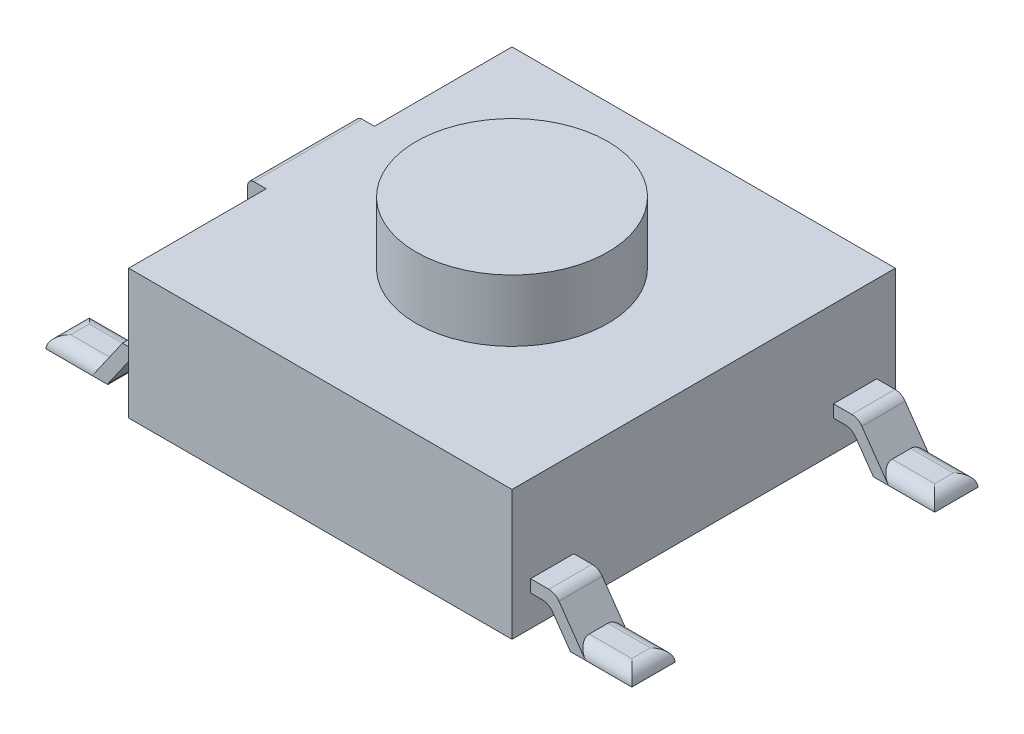
from build123d import *

# Parameters (mm, degrees)
ESQUISSE1_W         = 6.2
ESQUISSE1_H         = 6.2
BOSS_EXTRU_1_DEPTH  = 2.1
ESQUISSE2_R         = 1.55
BOSS_EXTRU_2_DEPTH  = 1
ESQUISSE3_W         = 1.75
ESQUISSE3_H         = 2.1
BOSS_EXTRU_3_DEPTH  = 0.3
ESQUISSE4_W         = 0.9
ESQUISSE4_H         = 0.1
BOSS_EXTRU_4_DEPTH  = 0.7
CONG_1_R            = 0.1
ESQUISSE5_W         = 0.7
ESQUISSE5_H         = 0.2
BOSS_EXTRU_5_DEPTH  = 0.4
ESQUISSE7_W         = 0.7
ESQUISSE7_H         = 0.2
BOSS_EXTRU_6_DEPTH  = 0.7
CONG_2_R            = 0.2
ESQUISSE9_W         = 1
ESQUISSE9_H         = 0.7
BOSS_EXTRU_7_DEPTH  = 0.2
CONG_3_R            = 0.2
CONG_4_R            = 0.2
ESQUISSE10_W        = 0.7
ESQUISSE10_H        = 0.2
BOSS_EXTRU_10_DEPTH = 0.4
ESQUISSE14_W        = 0.7
ESQUISSE14_H        = 0.2
BOSS_EXTRU_11_DEPTH = 0.7
ESQUISSE16_W        = 1
ESQUISSE16_H        = 0.7
BOSS_EXTRU_12_DEPTH = 0.2
CONG_5_R            = 0.2


with BuildPart() as part:
    # Esquisse1 → Boss.-Extru.1 (new body)
    with BuildSketch(Plane(origin=(0, 0, 0), x_dir=(1, 0, 0), z_dir=(0, 1, 0))):
        with Locations((3.1, 3.1)):
            Rectangle(ESQUISSE1_W, ESQUISSE1_H)
    extrude(amount=BOSS_EXTRU_1_DEPTH)

    # Esquisse2 → Boss.-Extru.2 (add)
    with BuildSketch(Plane(origin=(0, 2.1, 0), x_dir=(1, 0, 0), z_dir=(0, 1, 0))):
        with Locations(Location((3.1, 3.1, 0), (0, 0, 90))):
            Circle(ESQUISSE2_R)
    extrude(amount=BOSS_EXTRU_2_DEPTH)

    # Esquisse3 → Boss.-Extru.3 (add)
    with BuildSketch(Plane.ZY):
        with Locations((-3.1, 1.05)):
            Rectangle(ESQUISSE3_W, ESQUISSE3_H)
    extrude(amount=BOSS_EXTRU_3_DEPTH)

    # Esquisse4 → Boss.-Extru.4 (add)
    with BuildSketch(Plane.ZY.offset(0.3)):
        with Locations((-3.1, 0.05)):
            Rectangle(ESQUISSE4_W, ESQUISSE4_H)
    extrude(amount=BOSS_EXTRU_4_DEPTH)

    # Congé1
    cong_1_edges = [part.edges().sort_by_distance(p)[0] for p in [
        (-0.65, 0.1, -3.55),
        (-0.65, 0.1, -2.65),
        (-1, 0.1, -3.1),
        (-0.3, 2.1, -3.1),
    ]]
    fillet(cong_1_edges, radius=CONG_1_R - 0.0001)  # a hair under: the kernel refuses the full size
    cong_1_2_edges = [part.edges().sort_by_distance(p)[0] for p in [
        (-0.3, 0.1, -3.1),
        (-0.3, 0.070739967, -3.520739967),
        (-0.3, 0.070739967, -2.679260033),
    ]]
    fillet(cong_1_2_edges, radius=CONG_1_R)

    # Esquisse5 → Boss.-Extru.5 (add)
    with BuildSketch(Plane(origin=(6.2, 0, 0), x_dir=(0, 0, -1), z_dir=(1, 0, 0))):
        with Locations((0.65, 0.6)):
            Rectangle(ESQUISSE5_W, ESQUISSE5_H)
        with Locations((5.55, 0.6)):
            Rectangle(ESQUISSE5_W, ESQUISSE5_H)
    extrude(amount=BOSS_EXTRU_5_DEPTH)

    # Esquisse7 → Boss.-Extru.6 (add)
    with BuildSketch(Plane(origin=(1.84244111, -2.631278598, 0), x_dir=(0, 0, -1), z_dir=(-0.5735764363510502, 0.8191520442889889, 0))):
        with Locations((5.55, -5.707906998)):
            Rectangle(ESQUISSE7_W, ESQUISSE7_H)
        with Locations((0.65, -5.707906998)):
            Rectangle(ESQUISSE7_W, ESQUISSE7_H)
    extrude(amount=-BOSS_EXTRU_6_DEPTH)

    # Congé2
    cong_2_edges = [part.edges().sort_by_distance(p)[0] for p in [
        (6.49588659, 0.5, -5.55),
        (6.49588659, 0.5, -0.65),
        (6.6, 0.7, -0.65),
        (6.6, 0.7, -5.55),
    ]]
    fillet(cong_2_edges, radius=CONG_2_R)

    # Esquisse9 → Boss.-Extru.7 (add)
    with BuildSketch(Plane(origin=(0, 0, 0), x_dir=(1, 0, 0), z_dir=(0, 1, 0))):
        with Locations((7.337673097, 0.65)):
            Rectangle(ESQUISSE9_W, ESQUISSE9_H)
        with Locations((7.337673097, 5.55)):
            Rectangle(ESQUISSE9_W, ESQUISSE9_H)
    extrude(amount=BOSS_EXTRU_7_DEPTH)

    # Congé3
    cong_3_edges = [part.edges().sort_by_distance(p)[0] for p in [
        (7.837673097, 0.2, -0.65),
        (7.393888433, 0.2, -1),
        (7.393888433, 0.2, -0.3),
    ]]
    fillet(cong_3_edges, radius=CONG_3_R - 0.0001)  # a hair under: the kernel refuses the full size

    # Congé4
    cong_4_edges = [part.edges().sort_by_distance(p)[0] for p in [
        (7.393888433, 0.2, -5.9),
        (7.837673097, 0.2, -5.55),
        (7.393888433, 0.2, -5.2),
    ]]
    fillet(cong_4_edges, radius=CONG_4_R - 0.0001)  # a hair under: the kernel refuses the full size

    # Esquisse10 → Boss.-Extru.10 (add)
    with BuildSketch(Plane.ZY):
        with Locations((-5.55, 0.6)):
            Rectangle(ESQUISSE10_W, ESQUISSE10_H)
        with Locations((-0.65, 0.6)):
            Rectangle(ESQUISSE10_W, ESQUISSE10_H)
    extrude(amount=BOSS_EXTRU_10_DEPTH)

    # Esquisse14 → Boss.-Extru.11 (add)
    with BuildSketch(Plane(origin=(0.197296446, 0.281768526, 0), x_dir=(0, 0, -1), z_dir=(-0.5735764363510527, -0.8191520442889871, 0))):
        with Locations((0.65, -0.629164323)):
            Rectangle(ESQUISSE14_W, ESQUISSE14_H)
        with Locations((5.55, -0.629164323)):
            Rectangle(ESQUISSE14_W, ESQUISSE14_H)
    extrude(amount=BOSS_EXTRU_11_DEPTH)

    # Esquisse16 → Boss.-Extru.12 (add)
    with BuildSketch(Plane(origin=(0, 0, 0), x_dir=(1, 0, 0), z_dir=(0, 1, 0))):
        with Locations((-1.137673097, 0.65)):
            Rectangle(ESQUISSE16_W, ESQUISSE16_H)
        with Locations((-1.137673097, 5.55)):
            Rectangle(ESQUISSE16_W, ESQUISSE16_H)
    extrude(amount=BOSS_EXTRU_12_DEPTH)

    # Congé5
    cong_5_edges = [part.edges().sort_by_distance(p)[0] for p in [
        (-1.193888433, 0.2, -5.9),
        (-1.637673097, 0.2, -5.55),
        (-1.193888433, 0.2, -5.2),
        (-1.193888433, 0.2, -1),
        (-1.637673097, 0.2, -0.65),
        (-1.193888433, 0.2, -0.3),
    ]]
    fillet(cong_5_edges, radius=CONG_5_R - 0.0001)  # a hair under: the kernel refuses the full size


solid = part.part
